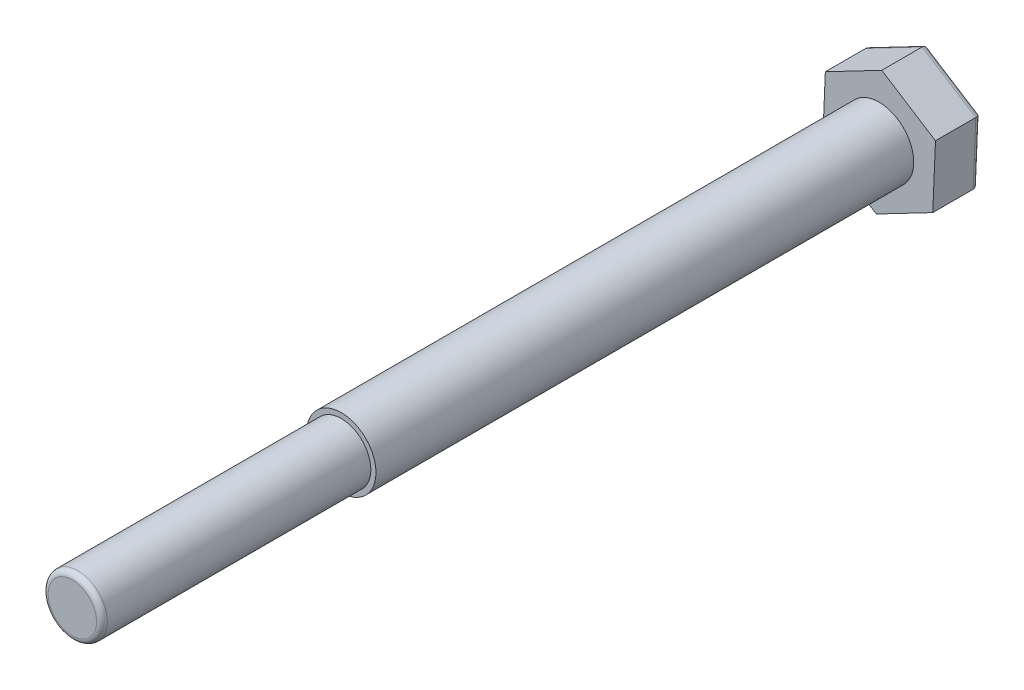
from build123d import *

# Parameters (mm, degrees)
EXTRUDE_309_DEPTH = 17
SKETCH_2_R        = 12.9
EXTRUDE_1_DEPTH   = 200
FILLET_3_R        = 2
SKETCH_3_R        = 11
EXTRUDE_2_DEPTH   = 100
FILLET_4_R        = 2


with BuildPart() as part:
    # 草图1 → Extrude 309 (new body)
    with BuildSketch(Plane.XY):
        Polygon((20.984201837, 10.954296262), (1.005402075, 23.65), (-19.978799762, 12.695703738), (-20.984201837, -10.954296262), (-1.005402075, -23.65), (19.978799762, -12.695703738), align=None)
    extrude(amount=EXTRUDE_309_DEPTH)

    # 草图2 → 凸台-拉伸1 (add)
    with BuildSketch(Plane.XY.offset(17)):
        Circle(SKETCH_2_R)
    extrude(amount=EXTRUDE_1_DEPTH)

    # 圆角3
    fillet_3_edges = [part.edges().sort_by_distance(p)[0] for p in [
        (10.994801956, 17.302148131, 0),
        (-9.486698843, 18.172851869, 0),
        (-20.4815008, 0.870703738, 0),
        (-10.994801956, -17.302148131, 0),
        (9.486698843, -18.172851869, 0),
        (20.4815008, -0.870703738, 0),
    ]]
    fillet(fillet_3_edges, radius=FILLET_3_R)

    # 草图3 → 凸台-拉伸2 (add)
    with BuildSketch(Plane.XY.offset(217)):
        Circle(SKETCH_3_R)
    extrude(amount=EXTRUDE_2_DEPTH)

    # 圆角4
    fillet_4_edges = [part.edges().sort_by_distance(p)[0] for p in [
        (-11, 0, 317),
    ]]
    fillet(fillet_4_edges, radius=FILLET_4_R)


solid = part.part
